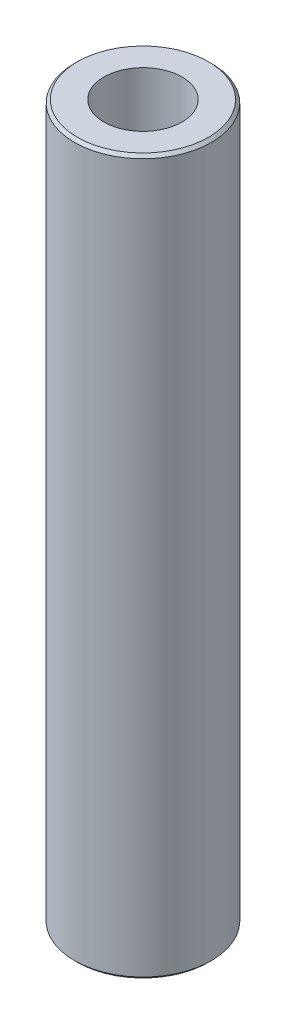
from build123d import *

# Parameters (mm, degrees)
SKETCH1_R           = 57.5
BOSS_EXTRUDE1_DEPTH = 600
SKETCH2_R           = 32.802496349
CUT_EXTRUDE1_DEPTH  = 606.485342515
CHAMFER1_SIZE       = 2.474818324


with BuildPart() as part:
    # Sketch1 → Boss-Extrude1 (new body)
    with BuildSketch(Plane(origin=(0, 0, 0), x_dir=(1, 0, 0), z_dir=(0, 1, 0))):
        Circle(SKETCH1_R)
    extrude(amount=BOSS_EXTRUDE1_DEPTH)

    # Sketch2 → Cut-Extrude1 (cut, through all)
    with BuildSketch(Plane(origin=(0, 0, 0), x_dir=(1, 0, 0), z_dir=(0, 1, 0))):
        Circle(SKETCH2_R)
    extrude(amount=CUT_EXTRUDE1_DEPTH, mode=Mode.SUBTRACT)

    # Chamfer1
    chamfer1_edges = [part.edges().sort_by_distance(p)[0] for p in [
        (-57.5, 600, 0),
        (-57.5, 0, 0),
    ]]
    chamfer(chamfer1_edges, length=CHAMFER1_SIZE)


solid = part.part
